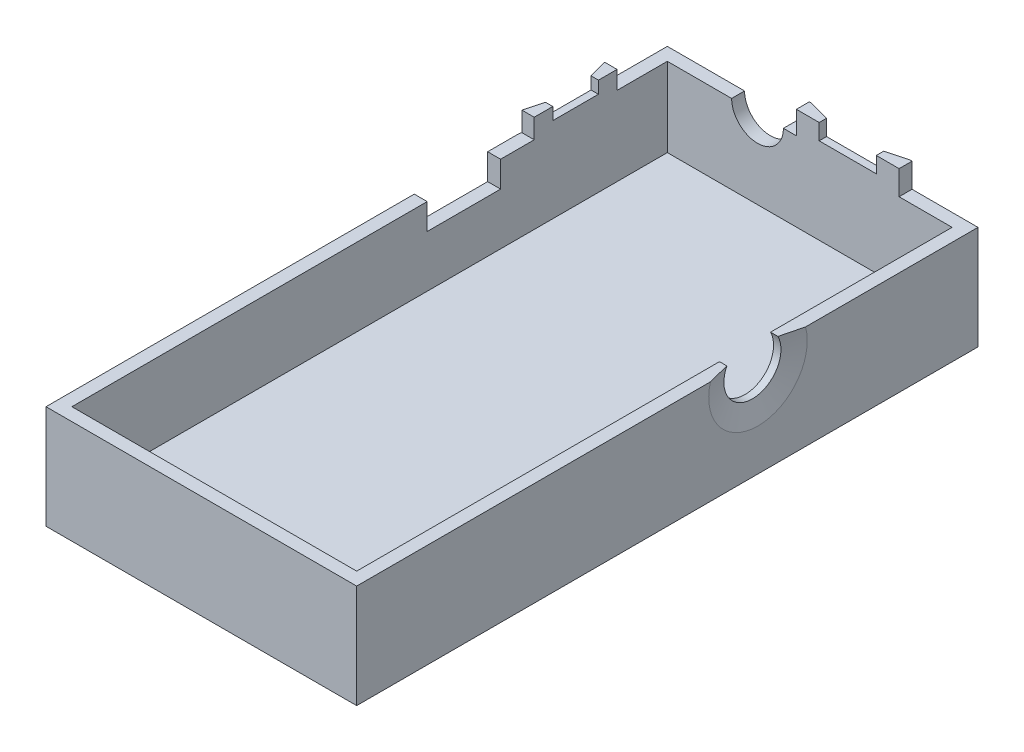
from build123d import *

# Parameters (mm, degrees)
SKETCH1_W           = 38.1
SKETCH1_H           = 76.2
BOSS_EXTRUDE1_DEPTH = 15.875
SKETCH4_W           = 34.925
SKETCH4_H           = 73.025
CUT_EXTRUDE2_DEPTH  = 12.7
CUT_EXTRUDE3_DEPTH  = 1.5875
CHAMFER1_SIZE       = 2.54
CHAMFER1_SIZE2      = 0.680590949
CUT_EXTRUDE4_DEPTH  = 1.5875
CHAMFER2_SIZE       = 2.54
CHAMFER2_SIZE2      = 0.680590949
SKETCH7_W           = 34.925
SKETCH7_H           = 3.175
CUT_EXTRUDE5_DEPTH  = 1.5875
CUT_EXTRUDE6_DEPTH  = 1.5875


with BuildPart() as part:
    # Sketch1 → Boss-Extrude1 (new body)
    with BuildSketch(Plane(origin=(0, 0, 0), x_dir=(1, 0, 0), z_dir=(0, 1, 0))):
        with Locations((-19.05, -38.1)):
            Rectangle(SKETCH1_W, SKETCH1_H)
    extrude(amount=BOSS_EXTRUDE1_DEPTH)

    # Sketch4 → Cut-Extrude2 (cut)
    with BuildSketch(Plane(origin=(0, 15.875, 0), x_dir=(1, 0, 0), z_dir=(0, 1, 0))):
        with Locations((-19.05, -38.1)):
            Rectangle(SKETCH4_W, SKETCH4_H)
    extrude(amount=-CUT_EXTRUDE2_DEPTH, mode=Mode.SUBTRACT)

    # Sketch5 → Cut-Extrude3 (cut)
    with BuildSketch(Plane(origin=(0, 0, 0), x_dir=(0, 0, -1), z_dir=(1, 0, 0))):
        with BuildLine():
            Line((0, 12.7), (-23.851432546, 12.7))
            ThreePointArc((-23.851432546, 12.7), (-26.9833, 7.6375), (-30.115167454, 12.7))
            Line((-30.115167454, 12.7), (-76.2, 12.7))
            Line((-76.2, 12.7), (-76.2, 15.875))
            Line((-76.2, 15.875), (0, 15.875))
            Line((0, 15.875), (0, 12.7))
        make_face()
    extrude(amount=-CUT_EXTRUDE3_DEPTH, mode=Mode.SUBTRACT)

    # Chamfer1
    chamfer1_edges = [part.edges().sort_by_distance(p)[0] for p in [
        (0, 7.6375, 26.9833),
    ]]
    chamfer1_side = [part.faces().sort_by_distance(p)[0] for p in [
        (0, 6.21970244, 38.453254935),
    ]]
    chamfer(chamfer1_edges, length=CHAMFER1_SIZE, length2=CHAMFER1_SIZE2, reference=chamfer1_side[0])

    # Sketch6 → Cut-Extrude4 (cut)
    with BuildSketch(Plane(origin=(0, 0, 0), x_dir=(-1, 0, 0), z_dir=(0, 0, -1))):
        with BuildLine():
            Line((1.5875, 12.7), (8.0883, 12.7))
            Line((8.0883, 12.7), (8.0883, 15.6875))
            Line((8.0883, 15.6875), (10.8883, 15.6875))
            Line((10.8883, 15.6875), (10.8883, 13.7375))
            Line((10.8883, 13.7375), (17.8883, 13.7375))
            Line((17.8883, 13.7375), (17.8883, 15.6875))
            Line((17.8883, 15.6875), (20.6883, 15.6875))
            Line((20.6883, 15.6875), (20.6883, 12.8725))
            Line((20.6883, 12.8725), (22.2783, 12.8725))
            ThreePointArc((22.2783, 12.8725), (25.4533, 9.6975), (28.6283, 12.8725))
            Line((28.6283, 12.8725), (38.1, 12.8725))
            Line((38.1, 12.8725), (38.1, 15.875))
            Line((38.1, 15.875), (1.5875, 15.875))
            Line((1.5875, 15.875), (1.5875, 12.7))
        make_face()
    extrude(amount=-CUT_EXTRUDE4_DEPTH, mode=Mode.SUBTRACT)

    # Chamfer2
    chamfer2_edges = [part.edges().sort_by_distance(p)[0] for p in [
        (-10.8883, 14.7125, 0),
        (-14.3883, 13.7375, 0),
        (-17.8883, 14.7125, 0),
    ]]
    chamfer2_side = [part.faces().sort_by_distance(p)[0] for p in [
        (-18.682001646, 6.589374137, 0),
    ]]
    chamfer(chamfer2_edges, length=CHAMFER2_SIZE, length2=CHAMFER2_SIZE2, reference=chamfer2_side[0])

    # Sketch7 → Cut-Extrude5 (cut)
    with BuildSketch(Plane.XY.offset(76.2)):
        with Locations((-19.05, 14.2875)):
            Rectangle(SKETCH7_W, SKETCH7_H)
    extrude(amount=-CUT_EXTRUDE5_DEPTH, mode=Mode.SUBTRACT)

    # Sketch8 → Cut-Extrude6 (cut)
    with BuildSketch(Plane.ZY.offset(38.1)):
        Polygon((76.2, 12.7), (31.0375, 12.7), (31.0375, 9.525), (22.0375, 9.525), (22.0375, 12.7), (17.913122854, 12.7), (17.913122854, 15.0975), (15.633122854, 15.0975), (15.633122854, 13.5975), (10.038122854, 13.5975), (10.033122854, 15.0975), (7.753122854, 15.0975), (7.753122854, 12.8725), (1.5875, 12.8725), (1.5875, 15.875), (76.2, 15.875), align=None)
    extrude(amount=-CUT_EXTRUDE6_DEPTH, mode=Mode.SUBTRACT)

    # Chamfer3
    # the kernel refuses this chamfer: 2.54, 0.680590949 mm, written as the material it takes off along each edge
    with BuildSketch(Plane(origin=(-38.1, 7.001863854, 10.060108308), x_dir=(-0.009967146577155543, -0.003333149238426835, -0.9999447715275398), z_dir=(0, 0.9999944444907404, -0.003333314814970836))) as chamfer3_piece_1_section:
        with BuildLine():
            Line((2.638269115, 0), (-0.105178835, -0.705873694))
            Line((-0.105178835, -0.705873694), (-0.155976312, -0.705367363))
            ThreePointArc((-0.155976312, -0.705367363), (-0.0543203, -0.352919594), (-0.050797477, 0.000506331))
            Line((-0.050797477, 0.000506331), (0.000506331, 0.050797477))
            ThreePointArc((0.000506331, 0.050797477), (1.319509841, 0.037650122), (2.638775446, 0.050797477))
            Line((2.638775446, 0.050797477), (2.638269115, 0))
        make_face()
    chamfer3_piece_1 = extrude(amount=14.69135391, mode=Mode.PRIVATE)
    chamfer3_piece_1 = split(chamfer3_piece_1, bisect_by=Plane(origin=(-37.899401738, 15.0975, 9.151337031), z_dir=(0, -1, 0)), keep=Keep.TOP, mode=Mode.PRIVATE)
    chamfer3_piece_1 = split(chamfer3_piece_1, bisect_by=Plane(origin=(-37.899401738, 13.5975, 9.151337031), z_dir=(0, 1, 0)), keep=Keep.TOP, mode=Mode.PRIVATE)
    add(chamfer3_piece_1, mode=Mode.SUBTRACT)
    with BuildSketch(Plane(origin=(-38.1, 13.5975, 15.633122854), x_dir=(-0.009967146577155547, -0.9999503267608394, 0), z_dir=(0, 0, -1))) as chamfer3_piece_2_section:
        with BuildLine():
            Line((2.638269115, 0), (-0.105178835, -0.705873694))
            Line((-0.105178835, -0.705873694), (-0.155976312, -0.705367363))
            ThreePointArc((-0.155976312, -0.705367363), (-0.0543203, -0.352919594), (-0.050797477, 0.000506331))
            Line((-0.050797477, 0.000506331), (0.000506331, 0.050797477))
            ThreePointArc((0.000506331, 0.050797477), (1.319509841, 0.037650122), (2.638775446, 0.050797477))
            Line((2.638775446, 0.050797477), (2.638269115, 0))
        make_face()
    chamfer3_piece_2 = extrude(amount=12.190672788, mode=Mode.PRIVATE)
    chamfer3_piece_2 = split(chamfer3_piece_2, bisect_by=Plane(origin=(-37.899362184, 12.704169113, 10.041100623), z_dir=(0, 0.003333314814970836, 0.9999944444907404)), keep=Keep.TOP, mode=Mode.PRIVATE)
    add(chamfer3_piece_2, mode=Mode.SUBTRACT)
    with BuildSketch(Plane(origin=(-38.1, 15.0975, 15.633122854), x_dir=(-0.009967146577155547, -2.3683581360028347e-15, 0.9999503267608394), z_dir=(0, -1, 0))) as chamfer3_piece_3:
        with BuildLine():
            Line((2.638269115, 0), (-0.105178835, -0.705873694))
            Line((-0.105178835, -0.705873694), (-0.155976312, -0.705367363))
            ThreePointArc((-0.155976312, -0.705367363), (-0.0543203, -0.352919594), (-0.050797477, 0.000506331))
            Line((-0.050797477, 0.000506331), (0.000506331, 0.050797477))
            ThreePointArc((0.000506331, 0.050797477), (1.319509841, 0.037650122), (2.638775446, 0.050797477))
            Line((2.638775446, 0.050797477), (2.638269115, 0))
        make_face()
    extrude(amount=1.5, mode=Mode.SUBTRACT)
    with BuildSketch(Plane(origin=(-38.1, 7.001863854, 10.060108308), x_dir=(-0.009967146577155543, -0.003333149238426835, -0.9999447715275398), z_dir=(0, 0.9999944444907404, -0.003333314814970836))) as chamfer3_piece_4a_section:
        with BuildLine():
            Line((2.638269115, 0), (-0.105178835, -0.705873694))
            Line((-0.105178835, -0.705873694), (-0.155976312, -0.705367363))
            ThreePointArc((-0.155976312, -0.705367363), (-0.0543203, -0.352919594), (-0.050797477, 0.000506331))
            Line((-0.050797477, 0.000506331), (0.000506331, 0.050797477))
            ThreePointArc((0.000506331, 0.050797477), (1.319509841, 0.037650122), (2.638775446, 0.050797477))
            Line((2.638775446, 0.050797477), (2.638269115, 0))
        make_face()
    chamfer3_piece_4a = extrude(amount=14.69135391, mode=Mode.PRIVATE)
    chamfer3_piece_4a = split(chamfer3_piece_4a, bisect_by=Plane(origin=(-37.899435258, 13.5975, 9.16460585), z_dir=(0, -1, 0)), keep=Keep.TOP, mode=Mode.PRIVATE)
    with BuildSketch(Plane(origin=(-38.1, 13.5975, 15.633122854), x_dir=(-0.009967146577155547, -0.9999503267608394, 0), z_dir=(0, 0, -1))) as chamfer3_piece_4b_section:
        with BuildLine():
            Line((2.638269115, 0), (-0.105178835, -0.705873694))
            Line((-0.105178835, -0.705873694), (-0.155976312, -0.705367363))
            ThreePointArc((-0.155976312, -0.705367363), (-0.0543203, -0.352919594), (-0.050797477, 0.000506331))
            Line((-0.050797477, 0.000506331), (0.000506331, 0.050797477))
            ThreePointArc((0.000506331, 0.050797477), (1.319509841, 0.037650122), (2.638775446, 0.050797477))
            Line((2.638775446, 0.050797477), (2.638269115, 0))
        make_face()
    chamfer3_piece_4b = extrude(amount=12.190672788, mode=Mode.PRIVATE)
    chamfer3_piece_4b = split(chamfer3_piece_4b, bisect_by=Plane(origin=(-37.899435258, 12.723987849, 10.041034561), z_dir=(0, -0.003333314814970836, -0.9999944444907404)), keep=Keep.TOP, mode=Mode.PRIVATE)
    chamfer3_piece_4 = chamfer3_piece_4a & chamfer3_piece_4b
    add(chamfer3_piece_4, mode=Mode.SUBTRACT)
    with BuildSketch(Plane(origin=(-38.1, 13.5975, 22.228795642), x_dir=(-0.00996714657715554, -0.9999503267608394, 0), z_dir=(0, 0, -1))) as chamfer3_piece_5a_section:
        with BuildLine():
            Line((2.638269115, 0), (-0.105178835, -0.705873694))
            Line((-0.105178835, -0.705873694), (-0.155976312, -0.705367363))
            ThreePointArc((-0.155976312, -0.705367363), (-0.0543203, -0.352919594), (-0.050797477, 0.000506331))
            Line((-0.050797477, 0.000506331), (0.000506331, 0.050797477))
            ThreePointArc((0.000506331, 0.050797477), (1.319509841, 0.037650122), (2.638775446, 0.050797477))
            Line((2.638775446, 0.050797477), (2.638269115, 0))
        make_face()
    chamfer3_piece_5a = extrude(amount=18.786345577, mode=Mode.PRIVATE)
    chamfer3_piece_5a = split(chamfer3_piece_5a, bisect_by=Plane(origin=(-37.899401738, 12.71321909, 15.633122854), z_dir=(0, 0, 1)), keep=Keep.TOP, mode=Mode.PRIVATE)
    with BuildSketch(Plane(origin=(-38.1, 15.0975, 15.633122854), x_dir=(-0.009967146577155547, -2.3683581360028347e-15, 0.9999503267608394), z_dir=(0, -1, 0))) as chamfer3_piece_5b_section:
        with BuildLine():
            Line((2.638269115, 0), (-0.105178835, -0.705873694))
            Line((-0.105178835, -0.705873694), (-0.155976312, -0.705367363))
            ThreePointArc((-0.155976312, -0.705367363), (-0.0543203, -0.352919594), (-0.050797477, 0.000506331))
            Line((-0.050797477, 0.000506331), (0.000506331, 0.050797477))
            ThreePointArc((0.000506331, 0.050797477), (1.319509841, 0.037650122), (2.638775446, 0.050797477))
            Line((2.638775446, 0.050797477), (2.638269115, 0))
        make_face()
    chamfer3_piece_5b = extrude(amount=8.095672788, mode=Mode.PRIVATE)
    chamfer3_piece_5b = split(chamfer3_piece_5b, bisect_by=Plane(origin=(-37.899401738, 13.5975, 16.517403764), z_dir=(0, -1, 0)), keep=Keep.TOP, mode=Mode.PRIVATE)
    chamfer3_piece_5 = chamfer3_piece_5a & chamfer3_piece_5b
    add(chamfer3_piece_5, mode=Mode.SUBTRACT)


solid = part.part
